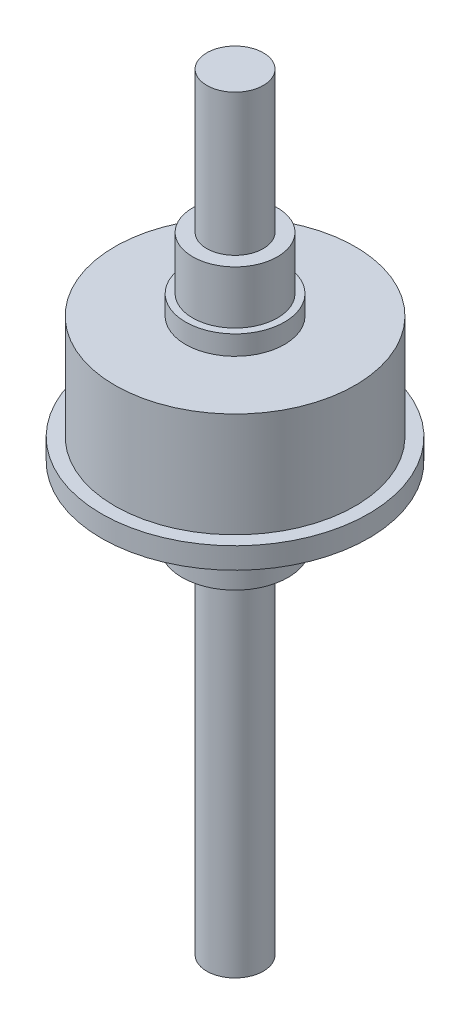
from build123d import *


with BuildPart() as part:
    # Sketch2 → Revolve1 (revolve)
    with BuildSketch(Plane.XY):
        Polygon((0, 0), (-4, 0), (-4, -20), (-6, -20), (-6, -27.5), (-7, -27.5), (-7, -30.25), (-17, -30.25), (-17, -45.05), (-18.9, -45.05), (-18.9, -48.05), (-10, -48.05), (-10, -50.55), (-7.5, -50.55), (-7.5, -58.55), (-4, -58.55), (-4, -108.55), (0, -108.55), align=None)
    revolve(axis=Axis((0, 40.033449689, 0), (0, -1, 0)))


solid = part.part
